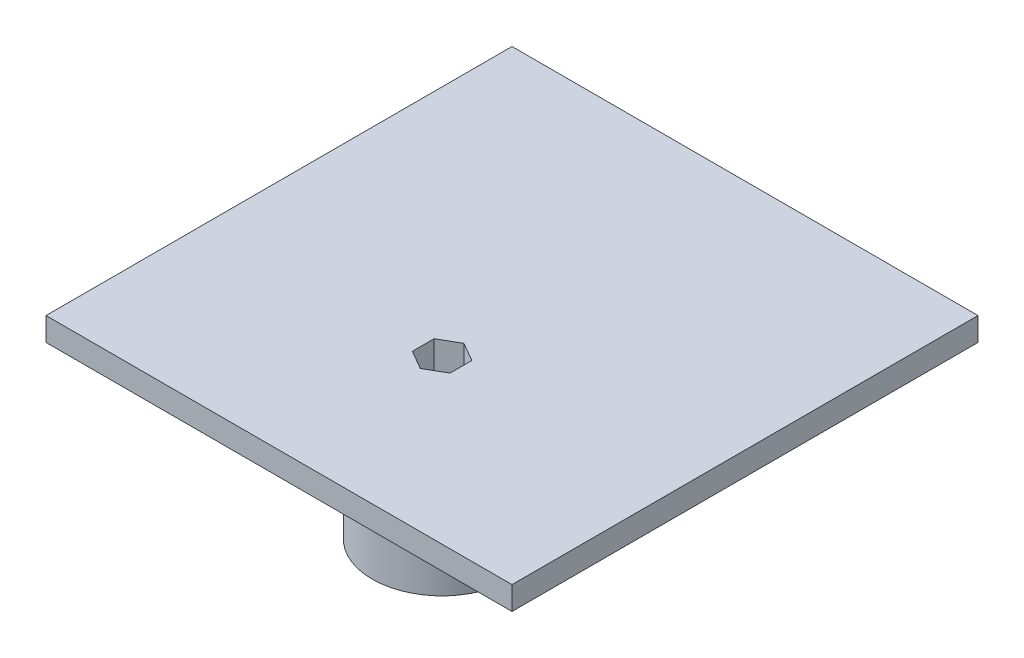
from build123d import *
from build123d.topology import SkipClean

# Parameters (mm, degrees)
ESQUISSE1_W             = 100
ESQUISSE1_H             = 100
ESQUISSE1_R             = 2.75
BOSS_EXTRU_1_DEPTH      = 5
BOSS_EXTRU_2_START      = 29
ESQUISSE2_R             = 2.75
BOSS_EXTRU_2_DEPTH      = 29
ESQUISSE3_W             = 30
ESQUISSE3_H             = 43.5
BOSS_EXTRU_3_DEPTH      = 29
CHANFREIN1_SIZE         = 29
CHANFREIN1_SIZE_2       = 45.5
ENL_V_START             = -30
ESQUISSE4_R             = 2.75
ENL_V_MAT_EXTRU_1_DEPTH = 30
ESQUISSE7_W             = 10
ESQUISSE7_H             = 29
ENL_V_MAT_EXTRU_2_DEPTH = 77.426435217


with BuildPart() as part:
    # Esquisse1 → Boss.-Extru.1 (new body)
    with BuildSketch(Plane(origin=(0, 0, 0), x_dir=(1, 0, 0), z_dir=(0, 1, 0))):
        Rectangle(ESQUISSE1_W, ESQUISSE1_H)
        with Locations(Location((0, -15, 0), (0, 0, 270))):
            Circle(ESQUISSE1_R, mode=Mode.SUBTRACT)
    extrude(amount=BOSS_EXTRU_1_DEPTH)

    # Esquisse2 → Boss.-Extru.2 (add)
    with SkipClean():  # the faces are left unmerged after this step: merging them gives an invalid solid
        with BuildSketch(Plane.XZ.offset(BOSS_EXTRU_2_START)):
            with BuildLine():
                ThreePointArc((-15, 15), (0, 30), (15, 15))
                Line((15, 15), (15, -1.5))
                Line((15, -1.5), (-15, -1.5))
                Line((-15, -1.5), (-15, 15))
            make_face()
            with Locations(Location((0, 15, 0), (0, 0, 270))):
                Circle(ESQUISSE2_R, mode=Mode.SUBTRACT)
        extrude(amount=-BOSS_EXTRU_2_DEPTH)

    # Esquisse3 → Boss.-Extru.3 (add)
    with SkipClean():  # the faces are left unmerged after this step: merging them gives an invalid solid
        with BuildSketch(Plane.XZ):
            with Locations((0, -23.25)):
                Rectangle(ESQUISSE3_W, ESQUISSE3_H)
        extrude(amount=BOSS_EXTRU_3_DEPTH)

    # Chanfrein1
    # the kernel refuses this chamfer: 45.5, 29 mm, written as the material it takes off along each edge
    with BuildSketch(Plane(origin=(-132.612350115, -29, -45), x_dir=(0, 0.9986920470194074, -0.051129201247289646), z_dir=(1, 0, 0))) as chanfrein1_piece_1_section:
        Polygon((CHANFREIN1_SIZE * 0.998692047019, CHANFREIN1_SIZE * 0.0511292012473), (-CHANFREIN1_SIZE_2 * 0.0511292012473, CHANFREIN1_SIZE_2 * 0.998692047019), (0, 0), align=None)
    chanfrein1_piece_1 = extrude(amount=265.22470023, mode=Mode.PRIVATE)
    chanfrein1_piece_1 = split(chanfrein1_piece_1, bisect_by=Plane(origin=(0, 0, -29.75832693), z_dir=(0, -1, 0)), keep=Keep.TOP, mode=Mode.PRIVATE)
    add(chanfrein1_piece_1, mode=Mode.SUBTRACT)

    # Esquisse4 → Enlèv. mat.-Extru.1 (cut)
    with BuildSketch(Plane(origin=(0, 5, 0), x_dir=(1, 0, 0), z_dir=(0, 1, 0)).offset(ENL_V_START)):
        Polygon((4.05, -17.33826859), (4.05, -12.66173141), (0, -10.32346282), (-4.05, -12.66173141), (-4.05, -17.33826859), (0, -19.67653718), align=None)
        with Locations(Location((0, -15, 0), (0, 0, 90))):
            Circle(ESQUISSE4_R, mode=Mode.SUBTRACT)
    extrude(amount=ENL_V_MAT_EXTRU_1_DEPTH, mode=Mode.SUBTRACT)

    # Esquisse7 → Enlèv. mat.-Extru.2 (cut, through all)
    with BuildSketch(Plane.XY):
        with Locations((-5, -14.5)):
            Rectangle(ESQUISSE7_W, ESQUISSE7_H)
        with Locations((5, -14.5)):
            Rectangle(ESQUISSE7_W, ESQUISSE7_H)
    extrude(amount=-ENL_V_MAT_EXTRU_2_DEPTH, mode=Mode.SUBTRACT)


solid = part.part
